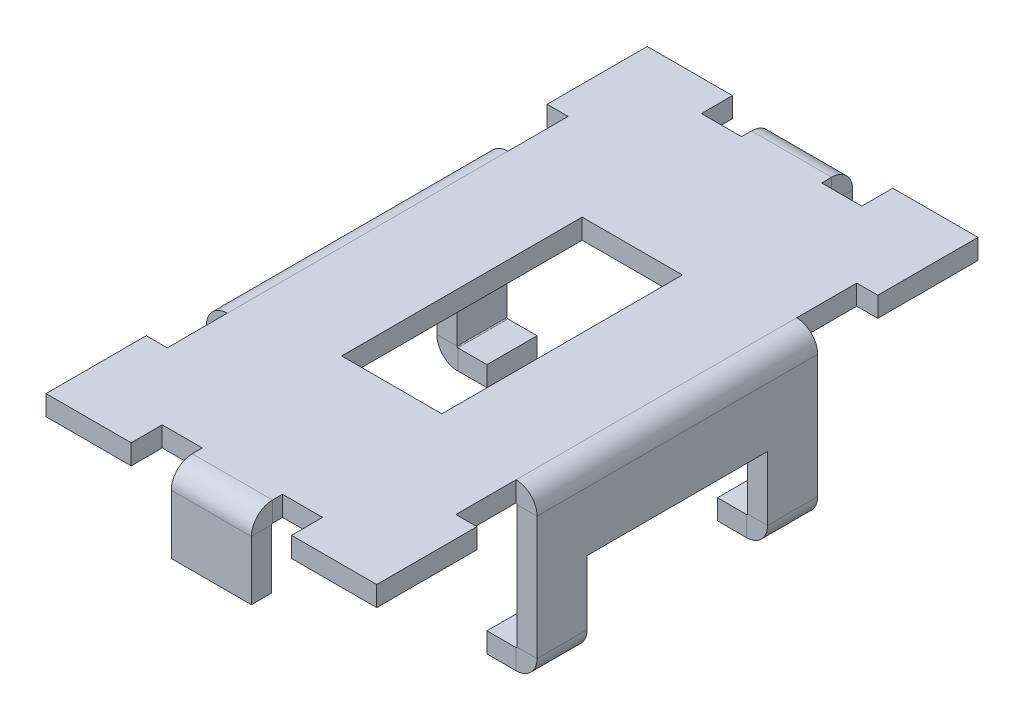
from build123d import *

# Parameters (mm, degrees)
SKETCH1_W                       = 3.3
SKETCH1_H                       = 6
BASE_FLANGE1_DEPTH              = 0.2
EDGE_FLANGE1_STRIP_W            = 0.82
EDGE_FLANGE1_STRIP_H            = 0.2
EDGE_FLANGE1_STRIP_CUT_DEPTH    = 0.8
EDGE_FLANGE1_RELIEF_W           = 0.92
EDGE_FLANGE1_RELIEF_H           = 0.4
EDGE_FLANGE1_RELIEF_CUT_DEPTH   = 0.2
EDGE_FLANGE1_STRIP_2_W          = 0.82
EDGE_FLANGE1_STRIP_2_H          = 0.2
EDGE_FLANGE1_STRIP_CUT_2_DEPTH  = 0.8
EDGE_FLANGE1_RELIEF_2_W         = 0.92
EDGE_FLANGE1_RELIEF_2_H         = 0.4
EDGE_FLANGE1_RELIEF_CUT_2_DEPTH = 0.2
EDGE_FLANGE1_DEPTH              = 0.8
EDGE_FLANGE1_BEND_DEPTH         = 0.8
EDGE_FLANGE2_STRIP_W            = 0.82
EDGE_FLANGE2_STRIP_H            = 0.2
EDGE_FLANGE2_STRIP_CUT_DEPTH    = 2.8
EDGE_FLANGE2_RELIEF_W           = 0.82
EDGE_FLANGE2_RELIEF_H           = 0.6
EDGE_FLANGE2_RELIEF_CUT_DEPTH   = 0.2
EDGE_FLANGE2_STRIP_2_W          = 0.82
EDGE_FLANGE2_STRIP_2_H          = 0.2
EDGE_FLANGE2_STRIP_CUT_2_DEPTH  = 2.8
EDGE_FLANGE2_RELIEF_2_W         = 0.82
EDGE_FLANGE2_RELIEF_2_H         = 0.6
EDGE_FLANGE2_RELIEF_CUT_2_DEPTH = 0.2
EDGE_FLANGE2_DEPTH              = 2.8
EDGE_FLANGE2_BEND_DEPTH         = 2.8
EDGE_FLANGE3_STRIP_W            = 0.82
EDGE_FLANGE3_STRIP_H            = 0.2
EDGE_FLANGE3_STRIP_CUT_DEPTH    = 2.8
EDGE_FLANGE3_STRIP_2_W          = 0.82
EDGE_FLANGE3_STRIP_2_H          = 0.2
EDGE_FLANGE3_STRIP_CUT_2_DEPTH  = 2.8
EDGE_FLANGE3_DEPTH              = 2.8
EDGE_FLANGE3_BEND_DEPTH         = 2.8
CUT_EXTRUDE1_DEPTH              = 10
CUT_EXTRUDE1_DEPTH_BACK         = 10
SKETCH23_W                      = 1.8
SKETCH23_H                      = 0.85
SKETCH24_W                      = 1
SKETCH24_H                      = 2.4
CUT_EXTRUDE2_DEPTH              = 10


# Sheet-metal steps are written as plain solids
with BuildPart() as part:
    # Sketch1 → Base-Flange1 (new body)
    with BuildSketch(Plane(origin=(0, 0, 0), x_dir=(1, 0, 0), z_dir=(0, 1, 0))):
        Rectangle(SKETCH1_W, SKETCH1_H)
    extrude(amount=-BASE_FLANGE1_DEPTH)

    # Edge-Flange1 strip (across the edge) → Edge-Flange1 strip cut (cut)
    with BuildSketch(Plane(origin=(0.4, -0.2, 3), x_dir=(0, 0, -1), z_dir=(-1, 0, 0))):
        with Locations((-0.2, -0.1)):
            Rectangle(EDGE_FLANGE1_STRIP_W, EDGE_FLANGE1_STRIP_H)
    extrude(amount=EDGE_FLANGE1_STRIP_CUT_DEPTH, mode=Mode.SUBTRACT)

    # Edge-Flange1 relief (on the sheet) → Edge-Flange1 relief cut (cut)
    with BuildSketch(Plane(origin=(0.4, -0.2, 2.79), x_dir=(0, 0, -1), z_dir=(0, -1, 0))):
        with Locations((-0.36, 0.2)):
            Rectangle(EDGE_FLANGE1_RELIEF_W, EDGE_FLANGE1_RELIEF_H)
        with Locations((-0.36, -1)):
            Rectangle(EDGE_FLANGE1_RELIEF_W, EDGE_FLANGE1_RELIEF_H)
    extrude(amount=-EDGE_FLANGE1_RELIEF_CUT_DEPTH, mode=Mode.SUBTRACT)

    # Edge-Flange1 strip 2 (across the edge) → Edge-Flange1 strip cut 2 (cut)
    with BuildSketch(Plane(origin=(-0.4, -0.2, -3), x_dir=(0, 0, 1), z_dir=(1, 0, 0))):
        with Locations((-0.2, -0.1)):
            Rectangle(EDGE_FLANGE1_STRIP_2_W, EDGE_FLANGE1_STRIP_2_H)
    extrude(amount=EDGE_FLANGE1_STRIP_CUT_2_DEPTH, mode=Mode.SUBTRACT)

    # Edge-Flange1 relief 2 (on the sheet) → Edge-Flange1 relief cut 2 (cut)
    with BuildSketch(Plane(origin=(-0.4, -0.2, -2.79), x_dir=(0, 0, 1), z_dir=(0, -1, 0))):
        with Locations((-0.36, 0.2)):
            Rectangle(EDGE_FLANGE1_RELIEF_2_W, EDGE_FLANGE1_RELIEF_2_H)
        with Locations((-0.36, -1)):
            Rectangle(EDGE_FLANGE1_RELIEF_2_W, EDGE_FLANGE1_RELIEF_2_H)
    extrude(amount=-EDGE_FLANGE1_RELIEF_CUT_2_DEPTH, mode=Mode.SUBTRACT)

    # Edge-Flange1 section (across the edge) → Edge-Flange1 (add)
    with BuildSketch(Plane(origin=(0.4, -0.2, 3), x_dir=(0, 0, -1), z_dir=(-1, 0, 0))):
        with BuildLine():
            Line((0, 0.01), (0, 0.6))
            Line((0, 0.6), (0.2, 0.6))
            Line((0.2, 0.6), (0.2, 0.01))
            ThreePointArc((0.2, 0.01), (0.202928932, 0.002928932), (0.21, 0))
            Line((0.21, 0), (0.21, -0.2))
            ThreePointArc((0.21, -0.2), (0.061507576, -0.138492424), (0, 0.01))
        make_face()
    extrude(amount=EDGE_FLANGE1_DEPTH)

    # Edge-Flange1 section 2 (across the edge) → Edge-Flange1 bend (add)
    with BuildSketch(Plane(origin=(-0.4, -0.2, -3), x_dir=(0, 0, 1), z_dir=(1, 0, 0))):
        with BuildLine():
            Line((0, 0.01), (0, 0.6))
            Line((0, 0.6), (0.2, 0.6))
            Line((0.2, 0.6), (0.2, 0.01))
            ThreePointArc((0.2, 0.01), (0.202928932, 0.002928932), (0.21, 0))
            Line((0.21, 0), (0.21, -0.2))
            ThreePointArc((0.21, -0.2), (0.061507576, -0.138492424), (0, 0.01))
        make_face()
    extrude(amount=EDGE_FLANGE1_BEND_DEPTH)

    # Edge-Flange2 strip (across the edge) → Edge-Flange2 strip cut (cut)
    with BuildSketch(Plane(origin=(-1.65, -0.2, 1.4), x_dir=(1, 0, 0), z_dir=(0, 0, -1))):
        with Locations((-0.2, -0.1)):
            Rectangle(EDGE_FLANGE2_STRIP_W, EDGE_FLANGE2_STRIP_H)
    extrude(amount=EDGE_FLANGE2_STRIP_CUT_DEPTH, mode=Mode.SUBTRACT)

    # Edge-Flange2 relief (on the sheet) → Edge-Flange2 relief cut (cut)
    with BuildSketch(Plane(origin=(-1.44, -0.2, 1.4), x_dir=(1, 0, 0), z_dir=(0, -1, 0))):
        with Locations((-0.41, 0.3)):
            Rectangle(EDGE_FLANGE2_RELIEF_W, EDGE_FLANGE2_RELIEF_H)
        with Locations((-0.41, -3.1)):
            Rectangle(EDGE_FLANGE2_RELIEF_W, EDGE_FLANGE2_RELIEF_H)
    extrude(amount=-EDGE_FLANGE2_RELIEF_CUT_DEPTH, mode=Mode.SUBTRACT)

    # Edge-Flange2 strip 2 (across the edge) → Edge-Flange2 strip cut 2 (cut)
    with BuildSketch(Plane(origin=(1.65, -0.2, -1.4), x_dir=(-1, 0, 0), z_dir=(0, 0, 1))):
        with Locations((-0.2, -0.1)):
            Rectangle(EDGE_FLANGE2_STRIP_2_W, EDGE_FLANGE2_STRIP_2_H)
    extrude(amount=EDGE_FLANGE2_STRIP_CUT_2_DEPTH, mode=Mode.SUBTRACT)

    # Edge-Flange2 relief 2 (on the sheet) → Edge-Flange2 relief cut 2 (cut)
    with BuildSketch(Plane(origin=(1.44, -0.2, -1.4), x_dir=(-1, 0, 0), z_dir=(0, -1, 0))):
        with Locations((-0.41, 0.3)):
            Rectangle(EDGE_FLANGE2_RELIEF_2_W, EDGE_FLANGE2_RELIEF_2_H)
        with Locations((-0.41, -3.1)):
            Rectangle(EDGE_FLANGE2_RELIEF_2_W, EDGE_FLANGE2_RELIEF_2_H)
    extrude(amount=-EDGE_FLANGE2_RELIEF_CUT_2_DEPTH, mode=Mode.SUBTRACT)

    # Edge-Flange2 section (across the edge) → Edge-Flange2 (add)
    with BuildSketch(Plane(origin=(-1.65, -0.2, 1.4), x_dir=(1, 0, 0), z_dir=(0, 0, -1))):
        with BuildLine():
            Line((0, 0.01), (0, 1.45))
            Line((0, 1.45), (0.2, 1.45))
            Line((0.2, 1.45), (0.2, 0.01))
            ThreePointArc((0.2, 0.01), (0.202928932, 0.002928932), (0.21, 0))
            Line((0.21, 0), (0.21, -0.2))
            ThreePointArc((0.21, -0.2), (0.061507576, -0.138492424), (0, 0.01))
        make_face()
    extrude(amount=EDGE_FLANGE2_DEPTH)

    # Edge-Flange2 section 2 (across the edge) → Edge-Flange2 bend (add)
    with BuildSketch(Plane(origin=(1.65, -0.2, -1.4), x_dir=(-1, 0, 0), z_dir=(0, 0, 1))):
        with BuildLine():
            Line((0, 0.01), (0, 1.45))
            Line((0, 1.45), (0.2, 1.45))
            Line((0.2, 1.45), (0.2, 0.01))
            ThreePointArc((0.2, 0.01), (0.202928932, 0.002928932), (0.21, 0))
            Line((0.21, 0), (0.21, -0.2))
            ThreePointArc((0.21, -0.2), (0.061507576, -0.138492424), (0, 0.01))
        make_face()
    extrude(amount=EDGE_FLANGE2_BEND_DEPTH)

    # Edge-Flange3 strip (across the edge) → Edge-Flange3 strip cut (cut)
    with BuildSketch(Plane(origin=(-1.45, -1.65, 1.4), x_dir=(0, 1, 0), z_dir=(0, 0, -1))):
        with Locations((-0.2, -0.1)):
            Rectangle(EDGE_FLANGE3_STRIP_W, EDGE_FLANGE3_STRIP_H)
    extrude(amount=EDGE_FLANGE3_STRIP_CUT_DEPTH, mode=Mode.SUBTRACT)

    # Edge-Flange3 strip 2 (across the edge) → Edge-Flange3 strip cut 2 (cut)
    with BuildSketch(Plane(origin=(1.45, -1.65, -1.4), x_dir=(0, 1, 0), z_dir=(0, 0, 1))):
        with Locations((-0.2, -0.1)):
            Rectangle(EDGE_FLANGE3_STRIP_2_W, EDGE_FLANGE3_STRIP_2_H)
    extrude(amount=EDGE_FLANGE3_STRIP_CUT_2_DEPTH, mode=Mode.SUBTRACT)

    # Edge-Flange3 section (across the edge) → Edge-Flange3 (add)
    with BuildSketch(Plane(origin=(-1.45, -1.65, 1.4), x_dir=(0, 1, 0), z_dir=(0, 0, -1))):
        with BuildLine():
            Line((0, 0.01), (0, 0.3))
            Line((0, 0.3), (0.2, 0.3))
            Line((0.2, 0.3), (0.2, 0.01))
            ThreePointArc((0.2, 0.01), (0.202928932, 0.002928932), (0.21, 0))
            Line((0.21, 0), (0.21, -0.2))
            ThreePointArc((0.21, -0.2), (0.061507576, -0.138492424), (0, 0.01))
        make_face()
    extrude(amount=EDGE_FLANGE3_DEPTH)

    # Edge-Flange3 section 2 (across the edge) → Edge-Flange3 bend (add)
    with BuildSketch(Plane(origin=(1.45, -1.65, -1.4), x_dir=(0, 1, 0), z_dir=(0, 0, 1))):
        with BuildLine():
            Line((0, 0.01), (0, 0.3))
            Line((0, 0.3), (0.2, 0.3))
            Line((0.2, 0.3), (0.2, 0.01))
            ThreePointArc((0.2, 0.01), (0.202928932, 0.002928932), (0.21, 0))
            Line((0.21, 0), (0.21, -0.2))
            ThreePointArc((0.21, -0.2), (0.061507576, -0.138492424), (0, 0.01))
        make_face()
    extrude(amount=EDGE_FLANGE3_BEND_DEPTH)

    # Sketch23 → Cut-Extrude1 (cut, two sides: drawn at the far end of the back side and taken through both)
    with BuildSketch(Plane(origin=(0, 0, 0), x_dir=(0, 0, -1), z_dir=(1, 0, 0)).offset(-CUT_EXTRUDE1_DEPTH_BACK)):
        with Locations((0, -1.225)):
            Rectangle(SKETCH23_W, SKETCH23_H)
    extrude(amount=CUT_EXTRUDE1_DEPTH + CUT_EXTRUDE1_DEPTH_BACK, mode=Mode.SUBTRACT)

    # Sketch24 → Cut-Extrude2 (cut)
    with BuildSketch(Plane(origin=(0, 0, 0), x_dir=(1, 0, 0), z_dir=(0, 1, 0))):
        Rectangle(SKETCH24_W, SKETCH24_H)
    extrude(amount=-CUT_EXTRUDE2_DEPTH, mode=Mode.SUBTRACT)


solid = part.part
